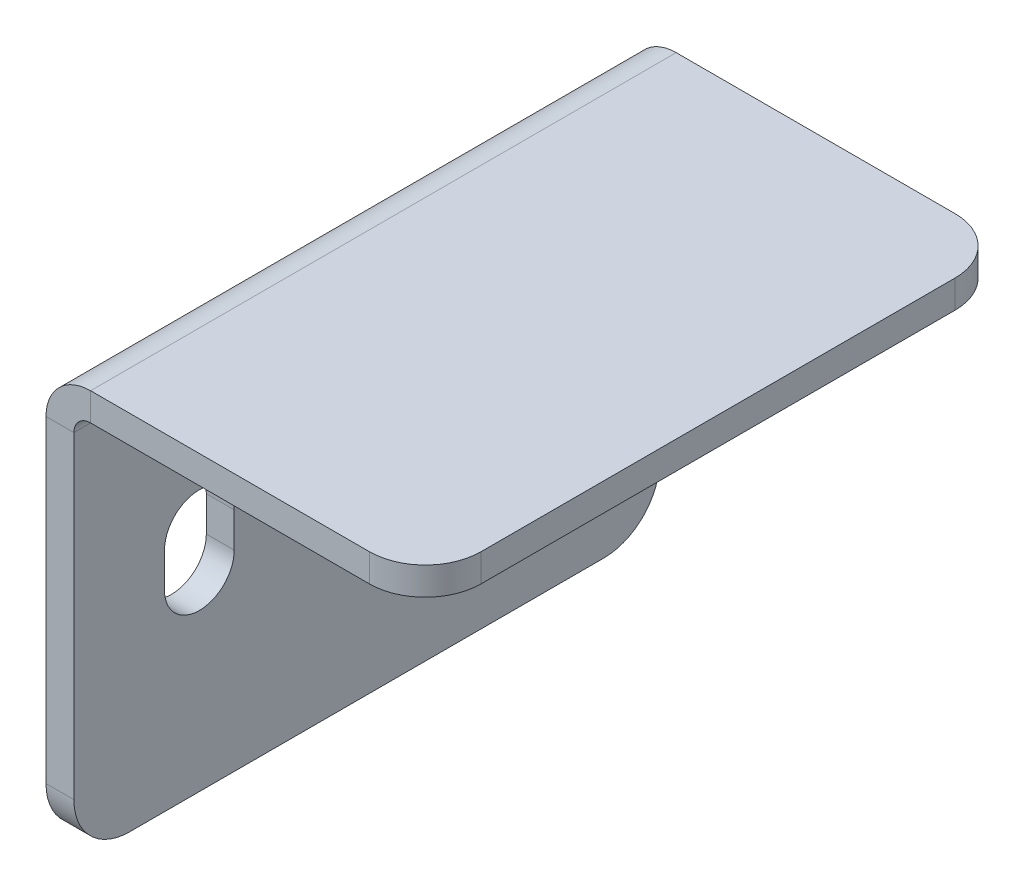
from build123d import *

# Parameters (mm, degrees)
SKETCH1_W          = 24
SKETCH1_H          = 42
BASE_FLANGE1_DEPTH = 2
EDGE_FLANGE1_DEPTH = 42
FILLET1_R          = 4
CUT_EXTRUDE1_DEPTH = 2


# Sheet-metal steps are written as plain solids
with BuildPart() as part:
    # Sketch1 → Base-Flange1 (new body)
    with BuildSketch(Plane(origin=(0, 0, 0), x_dir=(1, 0, 0), z_dir=(0, 1, 0))):
        Rectangle(SKETCH1_W, SKETCH1_H)
    extrude(amount=BASE_FLANGE1_DEPTH)

    # Edge-Flange1 section (across the edge) → Edge-Flange1 (add)
    with BuildSketch(Plane(origin=(-13.2, 0, 21), x_dir=(1, 0, 0), z_dir=(0, 0, -1))):
        with BuildLine():
            Line((-2, 1.2), (-2, 28))
            Line((-2, 28), (0, 28))
            Line((0, 28), (0, 1.2))
            ThreePointArc((0, 1.2), (0.351471863, 0.351471863), (1.2, 0))
            Line((1.2, 0), (1.2, -2))
            ThreePointArc((1.2, -2), (-1.0627417, -1.0627417), (-2, 1.2))
        make_face()
    extrude(amount=EDGE_FLANGE1_DEPTH)

    # Fillet1
    fillet1_edges = [part.edges().sort_by_distance(p)[0] for p in [
        (-14.2, -28, 21),
        (-14.2, -28, -21),
        (12, 1, 21),
        (12, 1, -21),
    ]]
    fillet(fillet1_edges, radius=FILLET1_R)

    # Sketch11 → Cut-Extrude1 (cut)
    with BuildSketch(Plane(origin=(-13.2, 0, 0), x_dir=(0, 0, -1), z_dir=(1, 0, 0))):
        with BuildLine():
            Line((9.5, -14.25), (9.5, -11.75))
            ThreePointArc((9.5, -11.75), (12, -9.25), (14.5, -11.75))
            Line((14.5, -11.75), (14.5, -14.25))
            ThreePointArc((14.5, -14.25), (12, -16.75), (9.5, -14.25))
        make_face()
        with BuildLine():
            Line((-9.5, -14.25), (-9.5, -11.75))
            ThreePointArc((-9.5, -11.75), (-12, -9.25), (-14.5, -11.75))
            Line((-14.5, -11.75), (-14.5, -14.25))
            ThreePointArc((-14.5, -14.25), (-12, -16.75), (-9.5, -14.25))
        make_face()
    extrude(amount=-CUT_EXTRUDE1_DEPTH, mode=Mode.SUBTRACT)


solid = part.part
